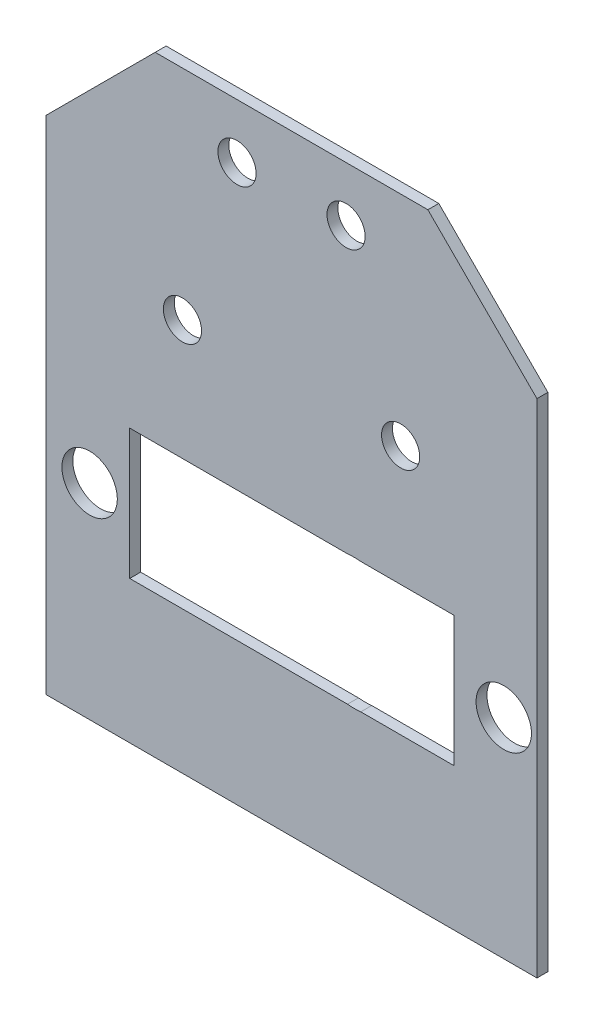
from build123d import *

# Parameters (mm, degrees)
PIASTRAOUT_ESTRUSIONE_ESTRUSIONE1_START  = -1
PIASTRAOUT_ESTRUSIONE_ESTRUSIONE1_OUTL_R = 1.75
PIASTRAOUT_ESTRUSIONE_ESTRUSIONE1_DEPTH  = 1
SCHIZZO1_R                               = 6
TAGLIO_ESTRUSIONE1_DEPTH                 = 48.914602295
SCHIZZO2_R                               = 2.54
TAGLIO_ESTRUSIONE2_DEPTH                 = 48.914602295
SCHIZZO3_W                               = 29.718
SCHIZZO3_H                               = 11.938
TAGLIO_ESTRUSIONE3_DEPTH                 = 48.914602295


# Read off the part's stored shape, not the designer's step: <PiastraOUT>-<Estrusione-Estrusione1>
with BuildPart() as part:
    # <PiastraOUT>-<Estrusione-Estrusione1> outl → <PiastraOUT>-<Estrusione-Estrusione1> (new body)
    with BuildSketch(Plane.XY.offset(PIASTRAOUT_ESTRUSIONE_ESTRUSIONE1_START)):
        Polygon((-22.5, 3.708640208), (-22.5, -42.291359792), (22.5, -42.291359792), (22.5, 3.708640208), (12.5, 13.708640208), (-12.5, 13.708640208), align=None)
        with Locations((-10, -6.291359792)):
            Circle(PIASTRAOUT_ESTRUSIONE_ESTRUSIONE1_OUTL_R, mode=Mode.SUBTRACT)
        with Locations((-5, 8.708640208)):
            Circle(PIASTRAOUT_ESTRUSIONE_ESTRUSIONE1_OUTL_R, mode=Mode.SUBTRACT)
        with Locations((10, -6.291359792)):
            Circle(PIASTRAOUT_ESTRUSIONE_ESTRUSIONE1_OUTL_R, mode=Mode.SUBTRACT)
        with Locations((5, 8.708640208)):
            Circle(PIASTRAOUT_ESTRUSIONE_ESTRUSIONE1_OUTL_R, mode=Mode.SUBTRACT)
    extrude(amount=PIASTRAOUT_ESTRUSIONE_ESTRUSIONE1_DEPTH)

    # Schizzo1 → Taglio-Estrusione1 (cut, through all)
    with BuildSketch(Plane.XY):
        with Locations((5.74, -23.264939262)):
            Circle(SCHIZZO1_R)
    extrude(amount=-TAGLIO_ESTRUSIONE1_DEPTH, mode=Mode.SUBTRACT)

    # Schizzo2 → Taglio-Estrusione2 (cut, through all)
    with BuildSketch(Plane.XY):
        with Locations((-18.513603064, -23.499799375)):
            Circle(SCHIZZO2_R)
        with Locations((19.455356967, -23.132126406)):
            Circle(SCHIZZO2_R)
    extrude(amount=-TAGLIO_ESTRUSIONE2_DEPTH, mode=Mode.SUBTRACT)

    # Schizzo3 → Taglio-Estrusione3 (cut, through all)
    with BuildSketch(Plane.XY):
        with Locations((0.025, -23.264939262)):
            Rectangle(SCHIZZO3_W, SCHIZZO3_H)
    extrude(amount=-TAGLIO_ESTRUSIONE3_DEPTH, mode=Mode.SUBTRACT)


solid = part.part
